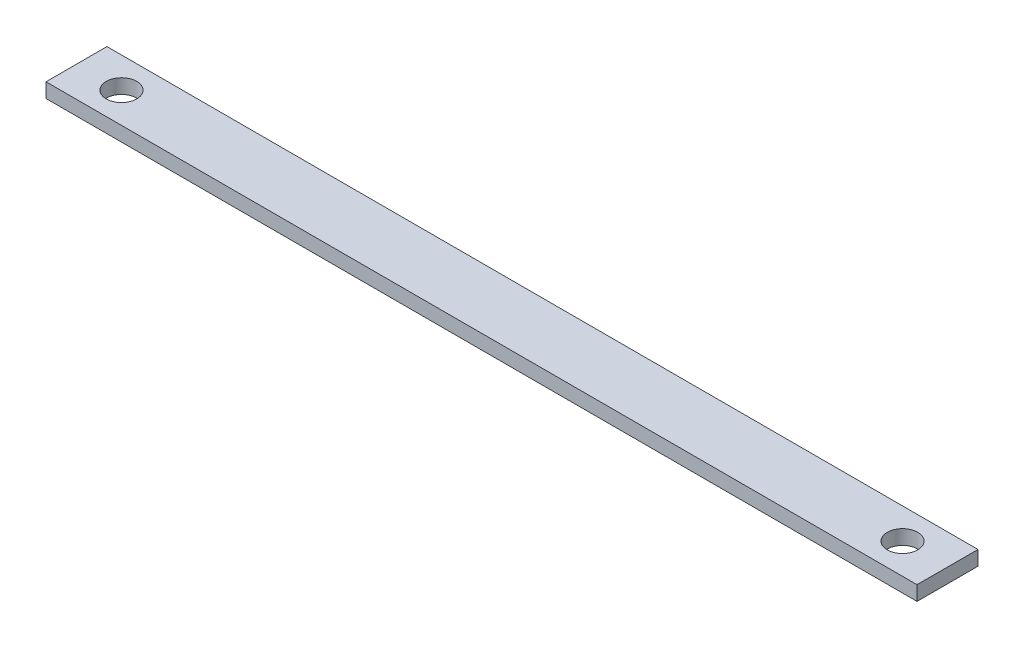
from build123d import *

# Parameters (mm, degrees)
ESQUISSE1_W             = 600
ESQUISSE1_H             = 42
BOSS_EXTRU_1_DEPTH      = 10
ESQUISSE2_R             = 10.5
ENL_V_MAT_EXTRU_1_DEPTH = 20


with BuildPart() as part:
    # Esquisse1 → Boss.-Extru.1 (new body)
    with BuildSketch(Plane(origin=(0, 0, 0), x_dir=(1, 0, 0), z_dir=(0, 1, 0))):
        Rectangle(ESQUISSE1_W, ESQUISSE1_H)
    extrude(amount=BOSS_EXTRU_1_DEPTH)

    # Esquisse2 → Enlèv. mat.-Extru.1 (cut)
    with BuildSketch(Plane(origin=(0, 10, 0), x_dir=(1, 0, 0), z_dir=(0, 1, 0))):
        with Locations((269, 0)):
            Circle(ESQUISSE2_R)
        with Locations((-269, 0)):
            Circle(ESQUISSE2_R)
    extrude(amount=-ENL_V_MAT_EXTRU_1_DEPTH, mode=Mode.SUBTRACT)


solid = part.part
